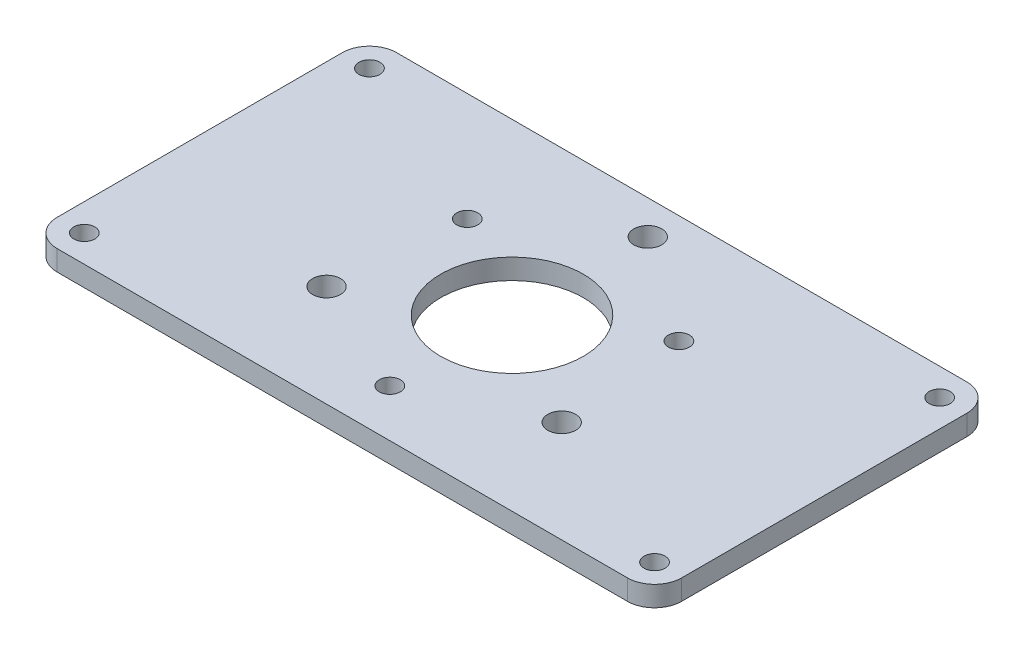
from build123d import *

# Parameters (mm, degrees)
SKETCH1_W           = 92
SKETCH1_H           = 50
SKETCH1_R           = 10.5
SKETCH1_R_2         = 1.55
SKETCH1_R_3         = 2.05
BOSS_EXTRUDE1_DEPTH = 3
FILLET1_R           = 4


with BuildPart() as part:
    # Sketch1 → Boss-Extrude1 (new body)
    with BuildSketch(Plane(origin=(0, 0, 0), x_dir=(1, 0, 0), z_dir=(0, 1, 0))):
        Rectangle(SKETCH1_W, SKETCH1_H)
        Circle(SKETCH1_R, mode=Mode.SUBTRACT)
        with Locations((42, 21)):
            Circle(SKETCH1_R_2, mode=Mode.SUBTRACT)
        with Locations((-42, 21)):
            Circle(SKETCH1_R_2, mode=Mode.SUBTRACT)
        with Locations((42, -21)):
            Circle(SKETCH1_R_2, mode=Mode.SUBTRACT)
        with Locations((-42, -21)):
            Circle(SKETCH1_R_2, mode=Mode.SUBTRACT)
        with Locations((0, 20)):
            Circle(SKETCH1_R_3, mode=Mode.SUBTRACT)
        with Locations((0, -18)):
            Circle(SKETCH1_R_2, mode=Mode.SUBTRACT)
        with Locations((-15.588457268, 9)):
            Circle(SKETCH1_R_2, mode=Mode.SUBTRACT)
        with Locations((17.320508076, -10)):
            Circle(SKETCH1_R_3, mode=Mode.SUBTRACT)
        with Locations((15.588457268, 9)):
            Circle(SKETCH1_R_2, mode=Mode.SUBTRACT)
        with Locations((-17.320508076, -10)):
            Circle(SKETCH1_R_3, mode=Mode.SUBTRACT)
    extrude(amount=BOSS_EXTRUDE1_DEPTH)

    # Fillet1
    fillet1_edges = [part.edges().sort_by_distance(p)[0] for p in [
        (46, 1.5, -25),
        (46, 1.5, 25),
        (-46, 1.5, 25),
        (-46, 1.5, -25),
    ]]
    fillet(fillet1_edges, radius=FILLET1_R)


solid = part.part
